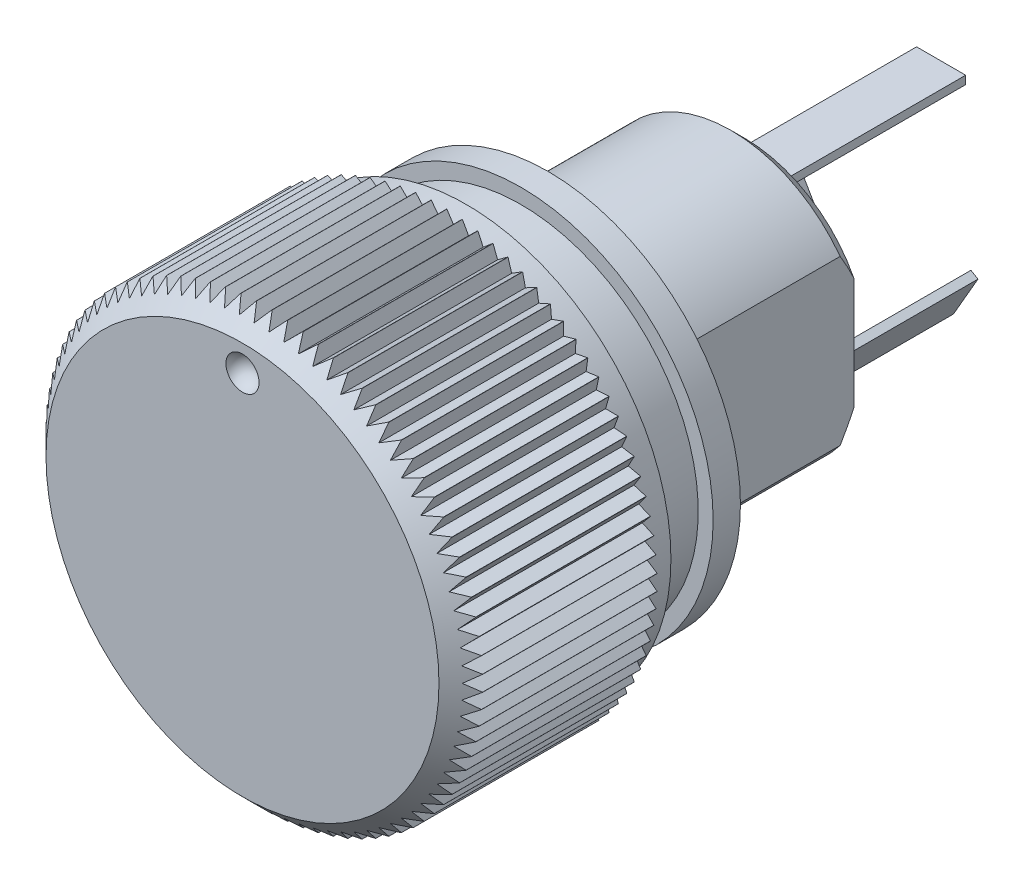
from build123d import *

# Parameters (mm, degrees)
SKETCH1_R             = 8
BOSS_EXTRUDE1_DEPTH   = 10.2
CHAMFER1_SIZE         = 0.8
SKETCH3_R             = 8.5
SKETCH3_R_2           = 7.5
CUT_EXTRUDE1_DEPTH    = 3
SKETCH4_R             = 7.5
SKETCH4_R_2           = 6.5
CUT_EXTRUDE2_DEPTH    = 2
SKETCH5_R             = 7.046482207
BOSS_EXTRUDE2_DEPTH   = 1
BOSS_EXTRUDE3_DEPTH   = 7.2
CHAMFER2_SIZE         = 0.5
BOSS_EXTRUDE4_DEPTH   = 7.2
SKETCH7_W             = 1.8
SKETCH7_H             = 0.3
BOSS_EXTRUDE4_2_DEPTH = 7.2
BOSS_EXTRUDE4_3_DEPTH = 7.2
SKETCH8_W             = 10.759070115
SKETCH8_H             = 3.708618866
CUT_EXTRUDE3_DEPTH    = 2
SKETCH9_R             = 0.605852561
CUT_EXTRUDE4_DEPTH    = 0.5
FILLET1_R             = 0.6
CUT_EXTRUDE5_DEPTH    = 28.988569095
CIRPATTERN1_COUNT     = 88


with BuildPart() as part:
    # Sketch1 → Boss-Extrude1 (new body)
    with BuildSketch(Plane.XY):
        Circle(SKETCH1_R)
    extrude(amount=BOSS_EXTRUDE1_DEPTH)

    # Chamfer1
    chamfer1_edges = [part.edges().sort_by_distance(p)[0] for p in [
        (-8, 0, 10.2),
    ]]
    chamfer(chamfer1_edges, length=CHAMFER1_SIZE)

    # Sketch3 → Cut-Extrude1 (cut)
    with BuildSketch(Plane(origin=(0, 0, 0), x_dir=(-1, 0, 0), z_dir=(0, 0, -1))):
        Circle(SKETCH3_R)
        Circle(SKETCH3_R_2, mode=Mode.SUBTRACT)
    extrude(amount=-CUT_EXTRUDE1_DEPTH, mode=Mode.SUBTRACT)

    # Sketch4 → Cut-Extrude2 (cut)
    with BuildSketch(Plane(origin=(0, 0, 0), x_dir=(-1, 0, 0), z_dir=(0, 0, -1))):
        Circle(SKETCH4_R)
        Circle(SKETCH4_R_2, mode=Mode.SUBTRACT)
    extrude(amount=-CUT_EXTRUDE2_DEPTH, mode=Mode.SUBTRACT)

    # Sketch5 → Boss-Extrude2 (add)
    with BuildSketch(Plane(origin=(0, 0, 0), x_dir=(-1, 0, 0), z_dir=(0, 0, -1))):
        Circle(SKETCH5_R)
    extrude(amount=BOSS_EXTRUDE2_DEPTH)

    # Sketch9 → Cut-Extrude4 (cut)
    with BuildSketch(Plane.XY.offset(10.2)):
        with Locations((0, 6.245558694)):
            Circle(SKETCH9_R)
    extrude(amount=-CUT_EXTRUDE4_DEPTH, mode=Mode.SUBTRACT)

    # Fillet1
    # the kernel refuses this fillet: 0.6 mm, written as the material it adds along each edge
    with BuildSketch(Plane(origin=(0, 6.245558694, 9.7), x_dir=(1, 0, 0), z_dir=(0, -1, 0))) as fillet1_piece_1:
        with BuildLine():
            CenterArc((0.014244582, 0.6), FILLET1_R, 270, 80.405931773)
            Line((0.014244582, 0), (0.014244582, -0.012))
            Line((0.014244582, -0.012), (0.605852561, -0.012))
            Line((0.605852561, -0.012), (0.617852561, 0))
            ThreePointArc((0.617852561, 0), (0.617852561, 0.25), (0.61768472, 0.498))
            Line((0.61768472, 0.498), (0.605852561, 0.5))
        make_face()
    revolve(axis=Axis((0, 6.245558694, 9.7), (0, 0, 1)))

    # Sketch10 → Cut-Extrude5 (cut, through all)
    with BuildSketch(Plane.XY.offset(10.2)):
        Polygon((0, 7.625668904), (-0.340299951, 8.071085443), (0.340299951, 8.071085443), align=None)
    cut_extrude5 = extrude(amount=-CUT_EXTRUDE5_DEPTH, mode=Mode.SUBTRACT)

    # CirPattern1: Cut-Extrude5 ×88 about axis
    cirpattern1_axis = Axis((0, 0, 0), (0, 0, 1))
    for i in range(1, CIRPATTERN1_COUNT):
        add(cut_extrude5.rotate(cirpattern1_axis, i * 360 / CIRPATTERN1_COUNT), mode=Mode.SUBTRACT)


with BuildPart() as body_2:
    # Sketch6 → Boss-Extrude3 (new body)
    with BuildSketch(Plane(origin=(0, 0, -1), x_dir=(-1, 0, 0), z_dir=(0, 0, -1))):
        with BuildLine():
            Line((-4, 3), (-4, -3))
            ThreePointArc((-4, -3), (0, -5), (4, -3))
            Line((4, -3), (4, 3))
            ThreePointArc((4, 3), (0, 5), (-4, 3))
        make_face()
    extrude(amount=BOSS_EXTRUDE3_DEPTH)

    # Chamfer2
    chamfer2_edges = [body_2.edges().sort_by_distance(p)[0] for p in [
        (0, -5, -8.2),
        (0, 5, -8.2),
    ]]
    chamfer(chamfer2_edges, length=CHAMFER2_SIZE)


with BuildPart() as body_3:
    # Sketch7 → Boss-Extrude4 (new body)
    with BuildSketch(Plane(origin=(0, 0, -8.2), x_dir=(-1, 0, 0), z_dir=(0, 0, -1))):
        Polygon((3.091377482, -0.745577137), (2.191377482, -2.304422863), (2.451185103, -2.454422863), (3.351185103, -0.895577137), align=None)
    extrude(amount=BOSS_EXTRUDE4_DEPTH)


with BuildPart() as body_4:
    # Sketch7 → Boss-Extrude4 2 (new body)
    with BuildSketch(Plane(origin=(0, 0, -8.2), x_dir=(-1, 0, 0), z_dir=(0, 0, -1))):
        with Locations((0, 3.2)):
            Rectangle(SKETCH7_W, SKETCH7_H)
    extrude(amount=BOSS_EXTRUDE4_2_DEPTH)


with BuildPart() as body_5:
    # Sketch7 → Boss-Extrude4 3 (new body)
    with BuildSketch(Plane(origin=(0, 0, -8.2), x_dir=(-1, 0, 0), z_dir=(0, 0, -1))):
        Polygon((-2.191377482, -2.304422863), (-3.091377482, -0.745577137), (-3.351185103, -0.895577137), (-2.451185103, -2.454422863), align=None)
    extrude(amount=BOSS_EXTRUDE4_3_DEPTH)


with BuildPart() as cut_extrude3_tool:
    # Sketch8 → Cut-Extrude3 (new body)
    with BuildSketch(Plane(origin=(0, 0, -15.4), x_dir=(-1, 0, 0), z_dir=(0, 0, -1))):
        with Locations((0.285278375, -1.477334438)):
            Rectangle(SKETCH8_W, SKETCH8_H)
    extrude(amount=-CUT_EXTRUDE3_DEPTH)


with BuildPart() as body_3_1:
    add(body_3.part)

    # Cut-Extrude3: cut by cut_extrude3_tool
    add(cut_extrude3_tool.part, mode=Mode.SUBTRACT)


with BuildPart() as body_5_1:
    add(body_5.part)

    # Cut-Extrude3: cut by cut_extrude3_tool
    add(cut_extrude3_tool.part, mode=Mode.SUBTRACT)


solid = Compound([part.part, body_2.part, body_4.part, body_3_1.part, body_5_1.part])
